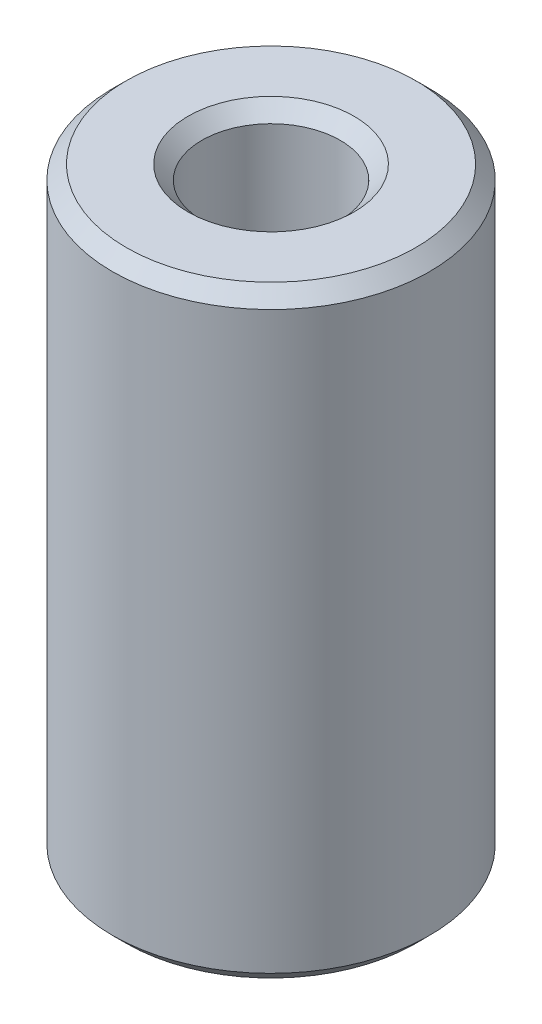
from build123d import *

# Parameters (mm, degrees)
SKETCH1_R           = 40
BOSS_EXTRUDE1_DEPTH = 152.033433129
SKETCH2_R           = 17.444705027
CUT_EXTRUDE1_DEPTH  = 163.216413439
CHAMFER1_SIZE       = 3.500043858


with BuildPart() as part:
    # Sketch1 → Boss-Extrude1 (new body)
    with BuildSketch(Plane(origin=(0, 0, 0), x_dir=(1, 0, 0), z_dir=(0, 1, 0))):
        Circle(SKETCH1_R)
    extrude(amount=BOSS_EXTRUDE1_DEPTH)

    # Sketch2 → Cut-Extrude1 (cut, through all)
    with BuildSketch(Plane(origin=(0, 0, 0), x_dir=(1, 0, 0), z_dir=(0, 1, 0))):
        Circle(SKETCH2_R)
    extrude(amount=CUT_EXTRUDE1_DEPTH, mode=Mode.SUBTRACT)

    # Chamfer1
    chamfer1_edges = [part.edges().sort_by_distance(p)[0] for p in [
        (-17.444705027, 152.033433129, 0),
        (-17.444705027, 0, 0),
        (-40, 0, 0),
        (-40, 152.033433129, 0),
    ]]
    chamfer(chamfer1_edges, length=CHAMFER1_SIZE)


solid = part.part
